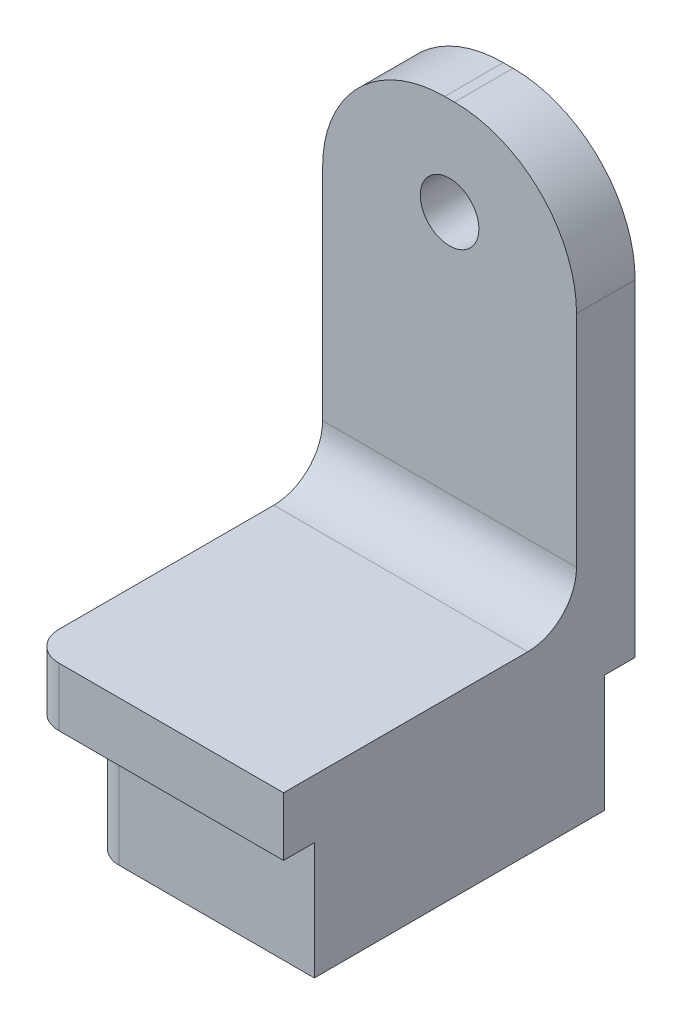
from build123d import *

# Parameters (mm, degrees)
BOSS_EXTRUDE1_DEPTH = 6
SKETCH2_W           = 26
SKETCH2_H           = 6
BOSS_EXTRUDE2_DEPTH = 40
FILLET1_R           = 12.5
SKETCH3_R           = 3
CUT_EXTRUDE1_DEPTH  = 74.228954843
BOSS_EXTRUDE3_DEPTH = 12
FILLET2_R           = 5


with BuildPart() as part:
    # Sketch1 → Boss-Extrude1 (new body)
    with BuildSketch(Plane(origin=(0, -44, 0), x_dir=(1, 0, 0), z_dir=(0, 1, 0))):
        with BuildLine():
            Line((50.264100782, -8), (50.264100782, 28))
            Line((50.264100782, 28), (27.264100782, 28))
            ThreePointArc((27.264100782, 28), (25.142780438, 27.121320344), (24.264100782, 25))
            Line((24.264100782, 25), (24.264100782, -5))
            ThreePointArc((24.264100782, -5), (25.142780438, -7.121320344), (27.264100782, -8))
            Line((27.264100782, -8), (50.264100782, -8))
        make_face()
    extrude(amount=BOSS_EXTRUDE1_DEPTH)

    # Sketch2 → Boss-Extrude2 (add)
    with BuildSketch(Plane(origin=(0, -38, 0), x_dir=(1, 0, 0), z_dir=(0, 1, 0))):
        with Locations((37.264100782, 25)):
            Rectangle(SKETCH2_W, SKETCH2_H)
    extrude(amount=BOSS_EXTRUDE2_DEPTH)

    # Fillet1
    fillet1_edges = [part.edges().sort_by_distance(p)[0] for p in [
        (24.264100782, 2, -25),
        (50.264100782, 2, -25),
    ]]
    fillet(fillet1_edges, radius=FILLET1_R)

    # Sketch3 → Cut-Extrude1 (cut, through all)
    with BuildSketch(Plane.XY.offset(-22)):
        with Locations((37.264100782, -8)):
            Circle(SKETCH3_R)
    extrude(amount=-CUT_EXTRUDE1_DEPTH, mode=Mode.SUBTRACT)

    # Sketch4 → Boss-Extrude3 (add)
    with BuildSketch(Plane.XZ.offset(44)):
        with BuildLine():
            Line((50.264100782, 4.85), (50.264100782, -24.85))
            Line((50.264100782, -24.85), (30.264100782, -24.85))
            ThreePointArc((30.264100782, -24.85), (28.248846455, -24.015254326), (27.414100782, -22))
            Line((27.414100782, -22), (27.414100782, 2))
            ThreePointArc((27.414100782, 2), (28.248846455, 4.015254326), (30.264100782, 4.85))
            Line((30.264100782, 4.85), (50.264100782, 4.85))
        make_face()
    extrude(amount=BOSS_EXTRUDE3_DEPTH)

    # Fillet2
    fillet2_edges = [part.edges().sort_by_distance(p)[0] for p in [
        (37.264100782, -38, -22),
    ]]
    fillet(fillet2_edges, radius=FILLET2_R)


solid = part.part
